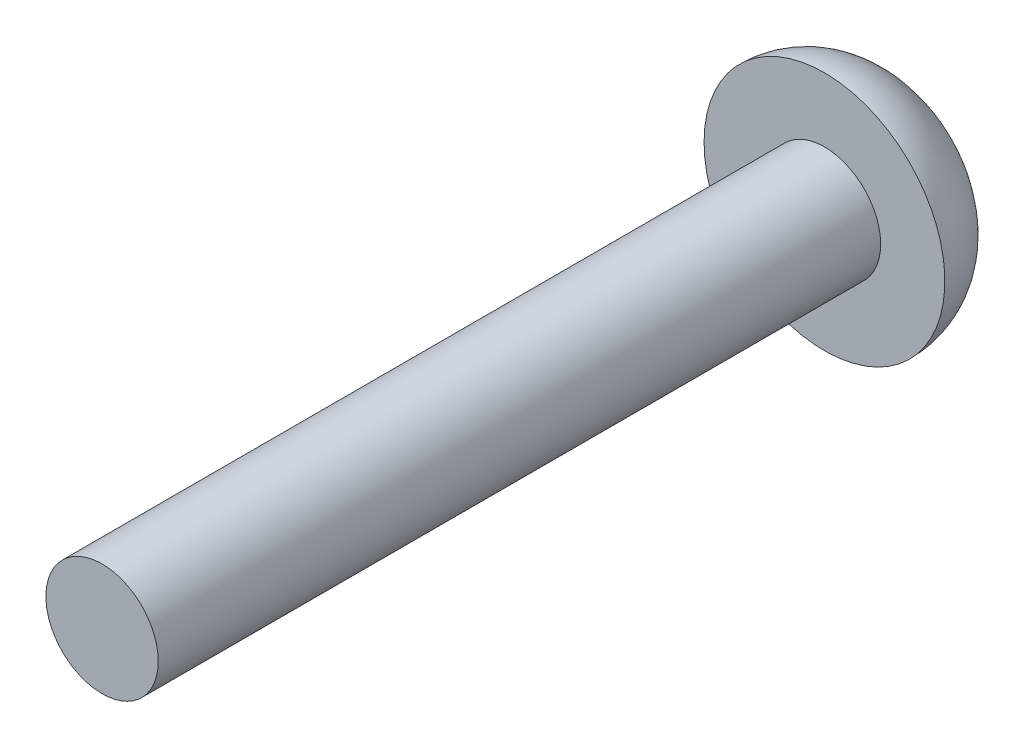
from build123d import *

# Parameters (mm, degrees)
ESQUISSE1_R        = 1.4
BOSS_EXTRU_1_DEPTH = 18
ESQUISSE2_R        = 3
BOSS_EXTRU_2_DEPTH = 2
CONG_2_R           = 2


with BuildPart() as part:
    # Esquisse1 → Boss.-Extru.1 (new body)
    with BuildSketch(Plane.XY):
        Circle(ESQUISSE1_R)
    extrude(amount=BOSS_EXTRU_1_DEPTH)

    # Esquisse2 → Boss.-Extru.2 (add)
    with BuildSketch(Plane(origin=(0, 0, 0), x_dir=(-1, 0, 0), z_dir=(0, 0, -1))):
        Circle(ESQUISSE2_R)
    extrude(amount=BOSS_EXTRU_2_DEPTH)

    # Congé2
    cong_2_edges = [part.edges().sort_by_distance(p)[0] for p in [
        (3, 0, -2),
    ]]
    fillet(cong_2_edges, radius=CONG_2_R - 0.0001)  # a hair under: the kernel refuses the full size


solid = part.part
